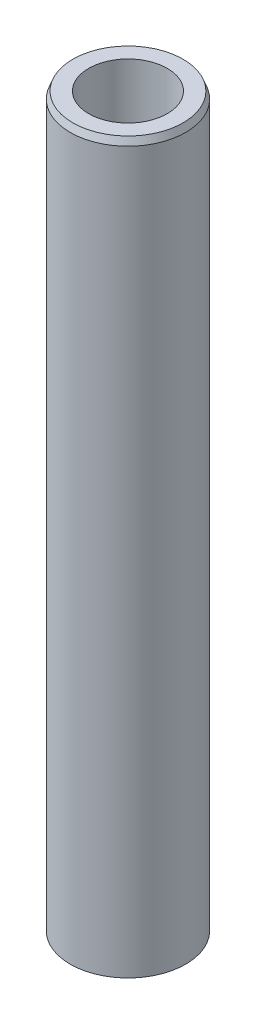
from build123d import *
from OCP.BRepFilletAPI import BRepFilletAPI_MakeChamfer

# Parameters (mm, degrees)
SKETCH1_R           = 47.5
BOSS_EXTRUDE1_DEPTH = 600
SKETCH2_R           = 32.294317938
CUT_EXTRUDE1_DEPTH  = 604.748706003
CHAMFER1_SIZE       = 5.735827307
CHAMFER1_SIZE2      = 2.182786007


with BuildPart() as part:
    # Sketch1 → Boss-Extrude1 (new body)
    with BuildSketch(Plane(origin=(0, 0, 0), x_dir=(1, 0, 0), z_dir=(0, 1, 0))):
        Circle(SKETCH1_R)
    extrude(amount=BOSS_EXTRUDE1_DEPTH)

    # Sketch2 → Cut-Extrude1 (cut, through all)
    with BuildSketch(Plane(origin=(0, 0, 0), x_dir=(1, 0, 0), z_dir=(0, 1, 0))):
        Circle(SKETCH2_R)
    extrude(amount=CUT_EXTRUDE1_DEPTH, mode=Mode.SUBTRACT)

    # Chamfer1: one chamfer whose edges measure the first distance from different faces: ONE call of the kernel's chamfer builder (chamfer() names one face for all edges)
    chamfer1_edges_1 = [part.edges().sort_by_distance(p)[0] for p in [
        (-47.5, 600, 0),
    ]]
    chamfer1_side_1 = [part.faces().sort_by_distance(p)[0] for p in [
        (-47.5, 300, 0),
    ]]
    chamfer1_edges_2 = [part.edges().sort_by_distance(p)[0] for p in [
        (-47.5, 0, 0),
    ]]
    chamfer1_side_2 = [part.faces().sort_by_distance(p)[0] for p in [
        (-46.156497116, 0, 0),
    ]]
    chamfer1 = BRepFilletAPI_MakeChamfer(part.part.solid().wrapped)
    for e in chamfer1_edges_1:
        chamfer1.Add(CHAMFER1_SIZE, CHAMFER1_SIZE2, e.wrapped, chamfer1_side_1[0].wrapped)  # the first distance lies on this face
    for e in chamfer1_edges_2:
        chamfer1.Add(CHAMFER1_SIZE, CHAMFER1_SIZE2, e.wrapped, chamfer1_side_2[0].wrapped)  # the first distance lies on this face
    add(Compound.cast(chamfer1.Shape()), mode=Mode.REPLACE)


solid = part.part
